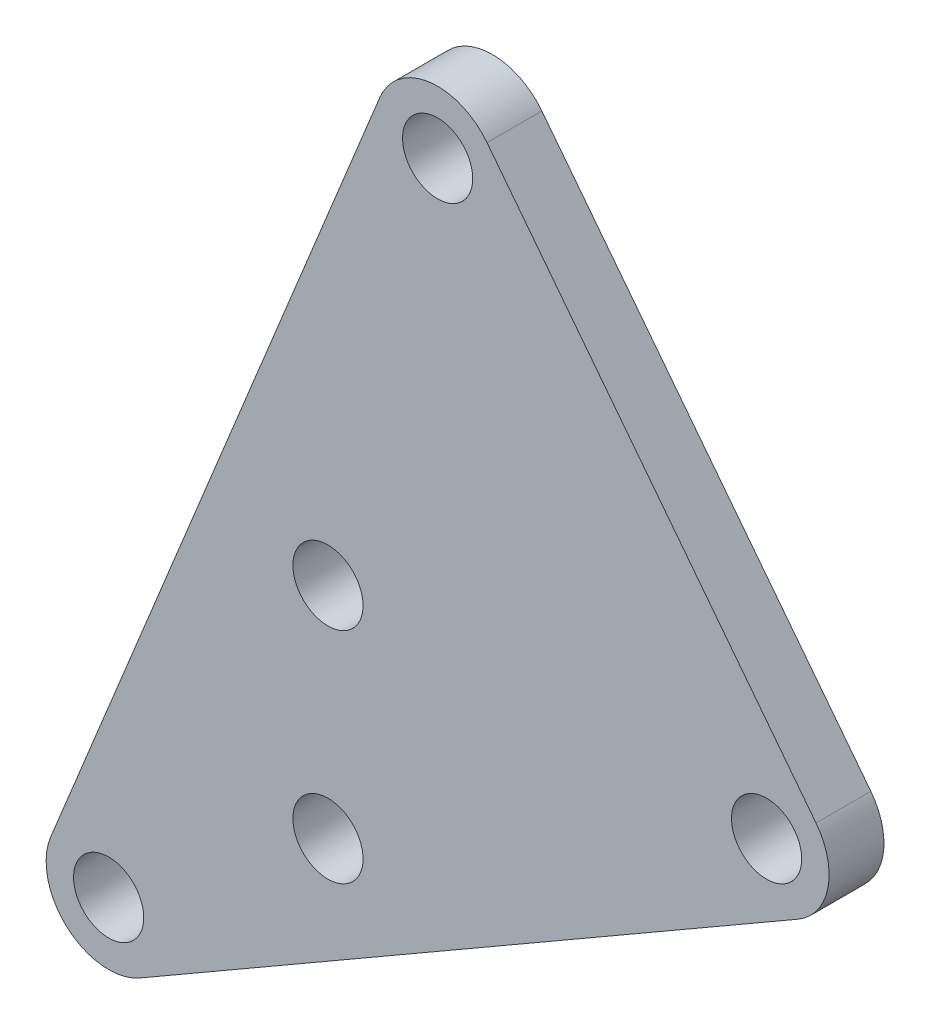
from build123d import *

# Parameters (mm, degrees)
SKETCH1_R           = 2.032
BOSS_EXTRUDE1_DEPTH = 3.175


with BuildPart() as part:
    # Sketch1 → Boss-Extrude1 (new body)
    with BuildSketch(Plane.XY):
        with BuildLine():
            Line((9.211465998, 26.809926279), (28.261465998, 2.216482031))
            ThreePointArc((28.261465998, 2.216482031), (28.951552918, -0.698034471), (27.20975, -3.134578949))
            Line((27.20975, -3.134578949), (-10.89025, -25.131624205))
            ThreePointArc((-10.89025, -25.131624205), (-15.080292043, -24.72376307), (-16.050262745, -20.627184026))
            Line((-16.050262745, -20.627184026), (2.999737255, 25.963305479))
            ThreePointArc((2.999737255, 25.963305479), (5.861203253, 28.17978751), (9.211465998, 26.809926279))
        make_face()
        Circle(SKETCH1_R, mode=Mode.SUBTRACT)
        with Locations((6.35, 24.593444248)):
            Circle(SKETCH1_R, mode=Mode.SUBTRACT)
        with Locations((-12.7, -21.997045256)):
            Circle(SKETCH1_R, mode=Mode.SUBTRACT)
        with Locations((25.4, 0)):
            Circle(SKETCH1_R, mode=Mode.SUBTRACT)
        with Locations((0, -12.7)):
            Circle(SKETCH1_R, mode=Mode.SUBTRACT)
    extrude(amount=BOSS_EXTRUDE1_DEPTH)


solid = part.part
